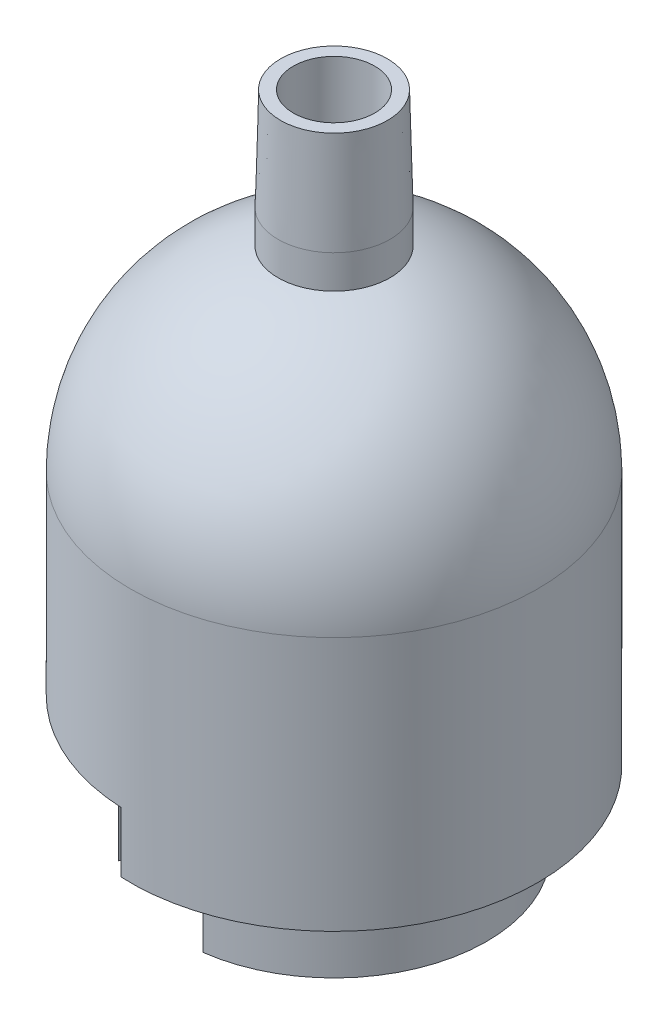
from build123d import *

# Parameters (mm, degrees)
ESBO_O1_R                     = 40
ESBO_O1_R_2                   = 30
RESSALTO_EXTRUS_O1_DEPTH      = 50
ESBO_O2_R                     = 1.5
CORTE_EXTRUS_O1_DEPTH         = 10
CORTE_EXTRUS_O2_DEPTH         = 11.84997677
RESSALTO_EXTRUS_O2_DEPTH      = 26.84997677
RESSALTO_EXTRUS_O2_DEPTH_BACK = 10
REVOLU_O1_ANGLE               = 180
RESSALTO_EXTRUS_O5_DEPTH      = 5
RESSALTO_EXTRUS_O5_DEPTH_BACK = 2
ESBO_O10_R                    = 11
ESBO_O13_R                    = 8
CORTE_EXTRUS_O4_DEPTH         = 40
ESCALA1_SCALE                 = 0.681818182


# Read off the part's stored shape, not the designer's step: Limites1
with BuildPart() as part:
    # Esboço1 → Ressalto-extrusão1 (new body)
    with BuildSketch(Plane(origin=(0, 0, 0), x_dir=(1, 0, 0), z_dir=(0, 1, 0))):
        with Locations(Location((0, 0, 0), (0, 0, 270))):
            Circle(ESBO_O1_R)
        with Locations(Location((0, 0, 0), (0, 0, 270))):
            Circle(ESBO_O1_R_2, mode=Mode.SUBTRACT)
    extrude(amount=RESSALTO_EXTRUS_O1_DEPTH)

    # Esboço2 → Corte-extrusão1 (cut)
    with BuildSketch(Plane(origin=(0, 0, 0), x_dir=(-1, 0, 0), z_dir=(0, -1, 0))):
        with Locations(Location((-21.160269083, -29.124611797, 0), (0, 0, 90))):
            Circle(ESBO_O2_R)
        with Locations(Location((-34.238034587, -11.124611797, 0), (0, 0, 90))):
            Circle(ESBO_O2_R)
        with Locations(Location((-34.238034587, 11.124611797, 0), (0, 0, 90))):
            Circle(ESBO_O2_R)
        with Locations(Location((21.160269083, 29.124611797, 0), (0, 0, 90))):
            Circle(ESBO_O2_R)
        with Locations(Location((34.238034587, 11.124611797, 0), (0, 0, 90))):
            Circle(ESBO_O2_R)
        with Locations(Location((34.238034587, -11.124611797, 0), (0, 0, 90))):
            Circle(ESBO_O2_R)
    extrude(amount=-CORTE_EXTRUS_O1_DEPTH, mode=Mode.SUBTRACT)

    # Esboço3 → Corte-extrusão2 (cut)
    with BuildSketch(Plane(origin=(0, 0, 0), x_dir=(-1, 0, 0), z_dir=(0, -1, 0))):
        with BuildLine():
            ThreePointArc((30.293924668, -13.087327008), (31.253408489, 10.593604572), (16.092357529, 28.81034587))
            Line((16.092357529, 28.81034587), (19.505887914, 34.921631358))
            ThreePointArc((19.505887914, 34.921631358), (8.030354378, 39.185627576), (-4.197370073, 39.779166463))
            Line((-4.197370073, 39.779166463), (-3.148027555, 29.834374847))
            ThreePointArc((-3.148027555, 29.834374847), (29.911212101, 2.306380417), (1.462902849, -29.964310692))
            Line((1.462902849, -29.964310692), (1.950537132, -39.952414256))
            ThreePointArc((1.950537132, -39.952414256), (22.185986252, -33.283359416), (36.126859334, -17.171197823))
            Line((36.126859334, -17.171197823), (30.293924668, -13.087327008))
        make_face()
    extrude(amount=-CORTE_EXTRUS_O2_DEPTH, mode=Mode.SUBTRACT)

    # Esboço4 → Ressalto-extrusão2 (add, two sides: drawn at the far end of the back side and taken through both)
    with BuildSketch(Plane(origin=(0, 11.84997677, 0), x_dir=(-1, 0, 0), z_dir=(0, -1, 0)).offset(-RESSALTO_EXTRUS_O2_DEPTH_BACK)):
        with BuildLine():
            Line((-4.008838629, -29.730947056), (-4.700362463, -27.602655537))
            ThreePointArc((-4.700362463, -27.602655537), (-8.119302432, 26.79695744), (19.230258499, -20.351834268))
            Line((19.230258499, -20.351834268), (19.909240802, -22.441526924))
            ThreePointArc((19.909240802, -22.441526924), (-8.745833796, 28.696870757), (-4.008838629, -29.730947056))
        make_face()
    extrude(amount=RESSALTO_EXTRUS_O2_DEPTH + RESSALTO_EXTRUS_O2_DEPTH_BACK)

    # Esboço9 → Revolução1 (revolve)
    with BuildSketch(Plane(origin=(0, 50, 0), x_dir=(1, 0, 0), z_dir=(0, 1, 0))):
        with BuildLine():
            Line((-40, 0), (-30, 0))
            ThreePointArc((-30, 0), (0, 30), (30, 0))
            Line((30, 0), (40, 0))
            ThreePointArc((40, 0), (0, 40), (-40, 0))
        make_face()
    revolve(axis=Axis((-40, 50, 0), (1, 0, 0)), revolution_arc=REVOLU_O1_ANGLE)

    # Esboço10 → Ressalto-extrusão5 (add, two sides: drawn at the far end of the back side and taken through both)
    with BuildSketch(Plane(origin=(0, 90, 0), x_dir=(1, 0, 0), z_dir=(0, 1, 0)).offset(-RESSALTO_EXTRUS_O5_DEPTH_BACK)):
        with Locations(Location((0, 0, 0), (0, 0, 270))):
            Circle(ESBO_O10_R)
    extrude(amount=RESSALTO_EXTRUS_O5_DEPTH + RESSALTO_EXTRUS_O5_DEPTH_BACK)

    # Limites1 outline → Limites1 (revolve)
    with BuildSketch(Plane.XY):
        Polygon((11, 95), (10.5, 115), (0, 115), (0, 95), align=None)
    revolve(axis=Axis((0, 0, 0), (0, 1, 0)))

    # Esboço13 → Corte-extrusão4 (cut)
    with BuildSketch(Plane(origin=(0, 115, 0), x_dir=(1, 0, 0), z_dir=(0, 1, 0))):
        with Locations(Location((0, 0, 0), (0, 0, 270))):
            Circle(ESBO_O13_R)
    extrude(amount=-CORTE_EXTRUS_O4_DEPTH, mode=Mode.SUBTRACT)


with BuildPart() as part_1:
    # Escala1: scaled about (0, 0, 0)
    add(part.part.scale(ESCALA1_SCALE))


solid = part_1.part
